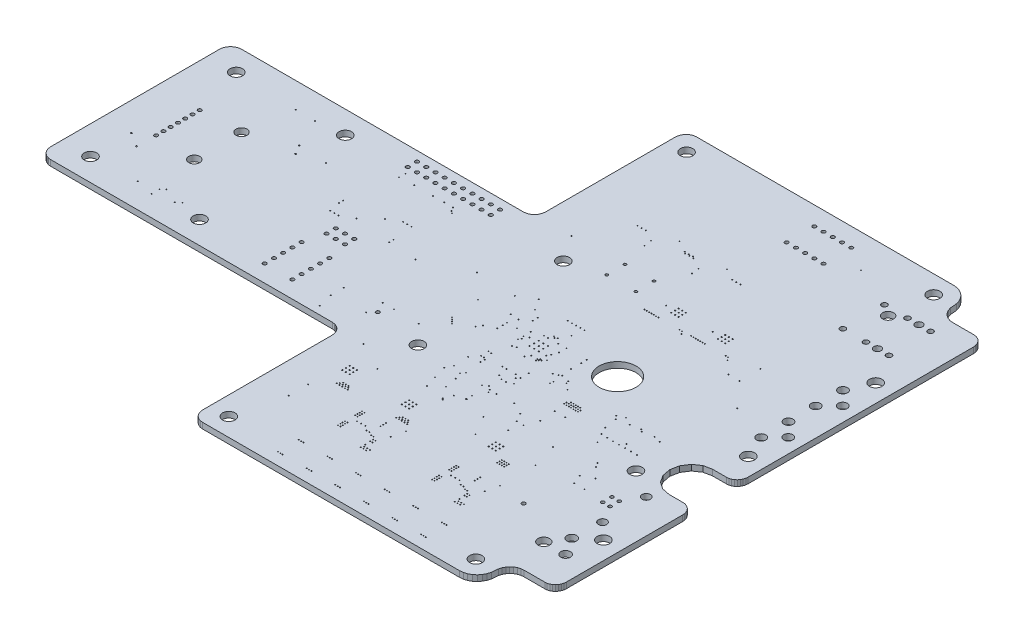
from build123d import *

# Parameters (mm, degrees)
BOARD_OUTLINE_DEPTH = 1.6
SKETCH2_R           = 5.08
SKETCH2_R_2         = 1.15
SKETCH2_R_3         = 1
SKETCH2_R_4         = 1.5
SKETCH2_R_5         = 0.127
SKETCH2_R_6         = 0.1905
SKETCH2_R_7         = 0.508
SKETCH2_R_8         = 1.7145
NPTH_DEPTH          = 116.781160961
SKETCH3_R           = 0.375
SKETCH3_R_2         = 1.59
SKETCH3_R_3         = 1.335
SKETCH3_R_4         = 0.46
SKETCH3_R_5         = 0.75
SKETCH3_R_6         = 1.25
SKETCH3_R_7         = 0.51
SKETCH3_R_8         = 0.5
SKETCH3_R_9         = 0.15
SKETCH3_R_10        = 1.5
PTH_DEPTH           = 116.781160961


with BuildPart() as part:
    # Sketch1 → Board_Outline (new body)
    with BuildSketch(Plane(origin=(0, 0, 0), x_dir=(1, 0, 0), z_dir=(0, 1, 0))):
        Polygon((90.797031, -59), (91.362359, -58.942359), (91.905959, -58.771641), (92.40695, -58.494409), (92.846069, -58.121319), (93.206441, -57.666709), (93.474219, -57.14805), (93.639131, -56.585269), (93.694809, -56), (93.694809, -24), (93.639131, -23.414731), (93.474219, -22.85195), (93.206441, -22.333291), (92.846069, -21.878681), (92.40695, -21.505591), (91.905959, -21.228359), (91.362359, -21.057641), (90.797031, -21), (86.933319, -21), (84.715459, -20.543281), (82.83525, -19.242641), (81.578931, -17.2961), (81.137769, -15), (81.578931, -12.7039), (82.83525, -10.757359), (84.715459, -9.456719), (86.933319, -9), (90.797031, -9), (91.362359, -8.942359), (91.905959, -8.771641), (92.40695, -8.494409), (92.846069, -8.121319), (93.206441, -7.666709), (93.474219, -7.14805), (93.639131, -6.585269), (93.694809, -6), (93.694809, 56), (93.639131, 56.585269), (93.474219, 57.14805), (93.206441, 57.666709), (92.846069, 58.121319), (92.40695, 58.494409), (91.905959, 58.771641), (91.362359, 58.942359), (90.797031, 59), (85.001469, 59), (84.2477, 59.076859), (83.5229, 59.304481), (82.854909, 59.674119), (82.269419, 60.171569), (81.788919, 60.777719), (81.431881, 61.469269), (81.212009, 62.219641), (81.137769, 63), (81.044969, 63.97545), (80.770141, 64.913419), (80.323831, 65.77785), (79.7232, 66.535531), (78.991341, 67.15735), (78.156359, 67.6194), (77.25035, 67.903931), (76.308141, 68), (5.518331, 68), (4.953, 67.942359), (4.4094, 67.771641), (3.908409, 67.494409), (3.469291, 67.121319), (3.108919, 66.666709), (2.841141, 66.14805), (2.676231, 65.585269), (2.62055, 65), (2.62055, 29.337), (2.516692, 28.54812), (2.212195, 27.813), (1.727811, 27.181739), (1.09655, 26.697355), (0.36143, 26.392858), (-0.42745, 26.289), (-77.978, 26.289), (-78.76688, 26.185142), (-79.502, 25.880645), (-80.133261, 25.396261), (-80.617645, 24.765), (-80.922142, 24.02988), (-81.026, 23.241), (-81.026, -23.241), (-80.922142, -24.02988), (-80.617645, -24.765), (-80.133261, -25.396261), (-79.502, -25.880645), (-78.76688, -26.185142), (-77.978, -26.289), (-0.42745, -26.289), (0.36143, -26.392858), (1.09655, -26.697355), (1.727811, -27.181739), (2.212195, -27.813), (2.516692, -28.54812), (2.62055, -29.337), (2.62055, -65), (2.676231, -65.585269), (2.841141, -66.14805), (3.108919, -66.666709), (3.469291, -67.121319), (3.908409, -67.494409), (4.4094, -67.771641), (4.953, -67.942359), (5.518331, -68), (76.308141, -68), (77.25035, -67.903931), (78.156359, -67.6194), (78.991341, -67.15735), (79.7232, -66.535531), (80.323831, -65.77785), (80.770141, -64.913419), (81.044969, -63.97545), (81.137769, -63), (81.212009, -62.219641), (81.431881, -61.469269), (81.788919, -60.777719), (82.269419, -60.171569), (82.854909, -59.674119), (83.5229, -59.304481), (84.2477, -59.076859), (85.001469, -59), align=None)
    extrude(amount=BOARD_OUTLINE_DEPTH)

    # Sketch2 → NPTH (cut, through all)
    with BuildSketch(Plane(origin=(0, 0, 0), x_dir=(1, 0, 0), z_dir=(0, 1, 0))):
        with Locations(Location((51.786, 0, 0), (0, 0, 270))):
            Circle(SKETCH2_R)
        with Locations(Location((84.391, -36.754, 0), (0, 0, 270))):
            Circle(SKETCH2_R_2)
        with Locations(Location((84.391, -24.714, 0), (0, 0, 270))):
            Circle(SKETCH2_R_2)
        with Locations(Location((80.874, 53.839, 0), (0, 0, 270))):
            Circle(SKETCH2_R_3)
        with Locations(Location((80.874, 42.409, 0), (0, 0, 270))):
            Circle(SKETCH2_R_3)
        with Locations(Location((74.524, 51.709, 0), (0, 0, 270))):
            Circle(SKETCH2_R_4)
        with Locations(Location((29.591, -4.191, 0), (0, 0, 270))):
            Circle(SKETCH2_R_5)
        with Locations(Location((29.972, -7.239, 0), (0, 0, 270))):
            Circle(SKETCH2_R_5)
        with Locations(Location((47.244, -22.225, 0), (0, 0, 270))):
            Circle(SKETCH2_R_5)
        with Locations(Location((29.206, -3.306, 0), (0, 0, 270))):
            Circle(SKETCH2_R_5)
        with Locations(Location((29.174, -1.306, 0), (0, 0, 270))):
            Circle(SKETCH2_R_5)
        with Locations(Location((29.19, -4.806, 0), (0, 0, 270))):
            Circle(SKETCH2_R_5)
        with Locations(Location((34.163, -8.001, 0), (0, 0, 270))):
            Circle(SKETCH2_R_5)
        with Locations(Location((38.136, -5.806, 0), (0, 0, 270))):
            Circle(SKETCH2_R_5)
        with Locations(Location((37.993, -2.306, 0), (0, 0, 270))):
            Circle(SKETCH2_R_5)
        with Locations(Location((38.025, -0.306, 0), (0, 0, 270))):
            Circle(SKETCH2_R_5)
        with Locations(Location((34.417, 0.889, 0), (0, 0, 270))):
            Circle(SKETCH2_R_5)
        with Locations(Location((33.909, 0.508, 0), (0, 0, 270))):
            Circle(SKETCH2_R_5)
        with Locations(Location((33.405, 0.893, 0), (0, 0, 270))):
            Circle(SKETCH2_R_5)
        with Locations(Location((55.753, -35.814, 0), (0, 0, 270))):
            Circle(SKETCH2_R_5)
        with Locations(Location((56.388, -35.814, 0), (0, 0, 270))):
            Circle(SKETCH2_R_5)
        with Locations(Location((55.753, -36.449, 0), (0, 0, 270))):
            Circle(SKETCH2_R_5)
        with Locations(Location((56.388, -36.449, 0), (0, 0, 270))):
            Circle(SKETCH2_R_5)
        with Locations(Location((55.753, -37.084, 0), (0, 0, 270))):
            Circle(SKETCH2_R_5)
        with Locations(Location((56.388, -37.084, 0), (0, 0, 270))):
            Circle(SKETCH2_R_5)
        with Locations(Location((57.023, -37.084, 0), (0, 0, 270))):
            Circle(SKETCH2_R_5)
        with Locations(Location((57.023, -36.449, 0), (0, 0, 270))):
            Circle(SKETCH2_R_5)
        with Locations(Location((57.023, -35.814, 0), (0, 0, 270))):
            Circle(SKETCH2_R_5)
        with Locations(Location((57.658, -35.814, 0), (0, 0, 270))):
            Circle(SKETCH2_R_5)
        with Locations(Location((57.658, -36.449, 0), (0, 0, 270))):
            Circle(SKETCH2_R_5)
        with Locations(Location((57.658, -37.084, 0), (0, 0, 270))):
            Circle(SKETCH2_R_5)
        with Locations(Location((50.8, -43.434, 0), (0, 0, 270))):
            Circle(SKETCH2_R_5)
        with Locations(Location((51.435, -43.434, 0), (0, 0, 270))):
            Circle(SKETCH2_R_5)
        with Locations(Location((50.8, -44.069, 0), (0, 0, 270))):
            Circle(SKETCH2_R_5)
        with Locations(Location((51.435, -44.069, 0), (0, 0, 270))):
            Circle(SKETCH2_R_5)
        with Locations(Location((51.435, -44.704, 0), (0, 0, 270))):
            Circle(SKETCH2_R_5)
        with Locations(Location((50.8, -44.704, 0), (0, 0, 270))):
            Circle(SKETCH2_R_5)
        with Locations(Location((50.8, -45.339, 0), (0, 0, 270))):
            Circle(SKETCH2_R_5)
        with Locations(Location((51.435, -45.339, 0), (0, 0, 270))):
            Circle(SKETCH2_R_5)
        with Locations(Location((61.595, -42.164, 0), (0, 0, 270))):
            Circle(SKETCH2_R_5)
        with Locations(Location((35.687, -42.164, 0), (0, 0, 270))):
            Circle(SKETCH2_R_5)
        with Locations(Location((24.892, -43.434, 0), (0, 0, 270))):
            Circle(SKETCH2_R_5)
        with Locations(Location((25.527, -43.434, 0), (0, 0, 270))):
            Circle(SKETCH2_R_5)
        with Locations(Location((24.892, -44.069, 0), (0, 0, 270))):
            Circle(SKETCH2_R_5)
        with Locations(Location((24.892, -44.704, 0), (0, 0, 270))):
            Circle(SKETCH2_R_5)
        with Locations(Location((24.892, -45.339, 0), (0, 0, 270))):
            Circle(SKETCH2_R_5)
        with Locations(Location((25.527, -44.069, 0), (0, 0, 270))):
            Circle(SKETCH2_R_5)
        with Locations(Location((25.527, -44.704, 0), (0, 0, 270))):
            Circle(SKETCH2_R_5)
        with Locations(Location((25.527, -45.339, 0), (0, 0, 270))):
            Circle(SKETCH2_R_5)
        with Locations(Location((14.732, -40.259, 0), (0, 0, 270))):
            Circle(SKETCH2_R_5)
        with Locations(Location((15.113, -39.751, 0), (0, 0, 270))):
            Circle(SKETCH2_R_5)
        with Locations(Location((15.494, -40.259, 0), (0, 0, 270))):
            Circle(SKETCH2_R_5)
        with Locations(Location((15.875, -39.751, 0), (0, 0, 270))):
            Circle(SKETCH2_R_5)
        with Locations(Location((16.256, -40.259, 0), (0, 0, 270))):
            Circle(SKETCH2_R_5)
        with Locations(Location((16.637, -39.751, 0), (0, 0, 270))):
            Circle(SKETCH2_R_5)
        with Locations(Location((17.018, -40.259, 0), (0, 0, 270))):
            Circle(SKETCH2_R_5)
        with Locations(Location((17.399, -39.751, 0), (0, 0, 270))):
            Circle(SKETCH2_R_5)
        with Locations(Location((17.78, -40.259, 0), (0, 0, 270))):
            Circle(SKETCH2_R_5)
        with Locations(Location((17.018, -39.243, 0), (0, 0, 270))):
            Circle(SKETCH2_R_5)
        with Locations(Location((16.256, -39.243, 0), (0, 0, 270))):
            Circle(SKETCH2_R_5)
        with Locations(Location((15.494, -39.243, 0), (0, 0, 270))):
            Circle(SKETCH2_R_5)
        with Locations(Location((31.115, -40.259, 0), (0, 0, 270))):
            Circle(SKETCH2_R_5)
        with Locations(Location((31.496, -39.751, 0), (0, 0, 270))):
            Circle(SKETCH2_R_5)
        with Locations(Location((31.877, -40.259, 0), (0, 0, 270))):
            Circle(SKETCH2_R_5)
        with Locations(Location((32.258, -39.751, 0), (0, 0, 270))):
            Circle(SKETCH2_R_5)
        with Locations(Location((32.639, -40.259, 0), (0, 0, 270))):
            Circle(SKETCH2_R_5)
        with Locations(Location((33.02, -39.751, 0), (0, 0, 270))):
            Circle(SKETCH2_R_5)
        with Locations(Location((33.401, -40.259, 0), (0, 0, 270))):
            Circle(SKETCH2_R_5)
        with Locations(Location((33.782, -39.751, 0), (0, 0, 270))):
            Circle(SKETCH2_R_5)
        with Locations(Location((34.163, -40.259, 0), (0, 0, 270))):
            Circle(SKETCH2_R_5)
        with Locations(Location((33.401, -39.243, 0), (0, 0, 270))):
            Circle(SKETCH2_R_5)
        with Locations(Location((32.639, -39.243, 0), (0, 0, 270))):
            Circle(SKETCH2_R_5)
        with Locations(Location((31.877, -39.243, 0), (0, 0, 270))):
            Circle(SKETCH2_R_5)
        with Locations(Location((50.419, -24.511, 0), (0, 0, 270))):
            Circle(SKETCH2_R_5)
        with Locations(Location((48.514, -24.511, 0), (0, 0, 270))):
            Circle(SKETCH2_R_5)
        with Locations(Location((11.049, -49.784, 0), (0, 0, 270))):
            Circle(SKETCH2_R_5)
        with Locations(Location((61.087, -51.562, 0), (0, 0, 270))):
            Circle(SKETCH2_R_5)
        with Locations(Location((59.182, -50.927, 0), (0, 0, 270))):
            Circle(SKETCH2_R_5)
        with Locations(Location((59.182, -52.197, 0), (0, 0, 270))):
            Circle(SKETCH2_R_5)
        with Locations(Location((59.563, -51.562, 0), (0, 0, 270))):
            Circle(SKETCH2_R_5)
        with Locations(Location((59.944, -52.197, 0), (0, 0, 270))):
            Circle(SKETCH2_R_5)
        with Locations(Location((60.325, -51.562, 0), (0, 0, 270))):
            Circle(SKETCH2_R_5)
        with Locations(Location((60.706, -52.197, 0), (0, 0, 270))):
            Circle(SKETCH2_R_5)
        with Locations(Location((63.627, -58.928, 0), (0, 0, 270))):
            Circle(SKETCH2_R_5)
        with Locations(Location((62.992, -58.928, 0), (0, 0, 270))):
            Circle(SKETCH2_R_5)
        with Locations(Location((62.357, -58.928, 0), (0, 0, 270))):
            Circle(SKETCH2_R_5)
        with Locations(Location((55.753, -58.928, 0), (0, 0, 270))):
            Circle(SKETCH2_R_5)
        with Locations(Location((55.118, -58.928, 0), (0, 0, 270))):
            Circle(SKETCH2_R_5)
        with Locations(Location((54.483, -58.928, 0), (0, 0, 270))):
            Circle(SKETCH2_R_5)
        with Locations(Location((47.879, -58.928, 0), (0, 0, 270))):
            Circle(SKETCH2_R_5)
        with Locations(Location((47.244, -58.928, 0), (0, 0, 270))):
            Circle(SKETCH2_R_5)
        with Locations(Location((46.609, -58.928, 0), (0, 0, 270))):
            Circle(SKETCH2_R_5)
        with Locations(Location((40.005, -58.928, 0), (0, 0, 270))):
            Circle(SKETCH2_R_5)
        with Locations(Location((39.37, -58.928, 0), (0, 0, 270))):
            Circle(SKETCH2_R_5)
        with Locations(Location((38.735, -58.928, 0), (0, 0, 270))):
            Circle(SKETCH2_R_5)
        with Locations(Location((32.131, -58.928, 0), (0, 0, 270))):
            Circle(SKETCH2_R_5)
        with Locations(Location((31.496, -58.928, 0), (0, 0, 270))):
            Circle(SKETCH2_R_5)
        with Locations(Location((30.861, -58.928, 0), (0, 0, 270))):
            Circle(SKETCH2_R_5)
        with Locations(Location((24.257, -58.928, 0), (0, 0, 270))):
            Circle(SKETCH2_R_5)
        with Locations(Location((23.622, -58.928, 0), (0, 0, 270))):
            Circle(SKETCH2_R_5)
        with Locations(Location((22.987, -58.928, 0), (0, 0, 270))):
            Circle(SKETCH2_R_5)
        with Locations(Location((41.529, 23.622, 0), (0, 0, 270))):
            Circle(SKETCH2_R_5)
        with Locations(Location((39.497, 19.685, 0), (0, 0, 270))):
            Circle(SKETCH2_R_5)
        with Locations(Location((40.132, 19.685, 0), (0, 0, 270))):
            Circle(SKETCH2_R_5)
        with Locations(Location((40.767, 19.685, 0), (0, 0, 270))):
            Circle(SKETCH2_R_5)
        with Locations(Location((41.402, 19.685, 0), (0, 0, 270))):
            Circle(SKETCH2_R_5)
        with Locations(Location((42.037, 19.685, 0), (0, 0, 270))):
            Circle(SKETCH2_R_5)
        with Locations(Location((42.672, 19.685, 0), (0, 0, 270))):
            Circle(SKETCH2_R_5)
        with Locations(Location((43.307, 19.685, 0), (0, 0, 270))):
            Circle(SKETCH2_R_5)
        with Locations(Location((52.197, 19.812, 0), (0, 0, 270))):
            Circle(SKETCH2_R_5)
        with Locations(Location((52.832, 19.812, 0), (0, 0, 270))):
            Circle(SKETCH2_R_5)
        with Locations(Location((53.467, 19.812, 0), (0, 0, 270))):
            Circle(SKETCH2_R_5)
        with Locations(Location((54.102, 19.812, 0), (0, 0, 270))):
            Circle(SKETCH2_R_5)
        with Locations(Location((54.737, 19.812, 0), (0, 0, 270))):
            Circle(SKETCH2_R_5)
        with Locations(Location((55.372, 19.812, 0), (0, 0, 270))):
            Circle(SKETCH2_R_5)
        with Locations(Location((56.007, 19.812, 0), (0, 0, 270))):
            Circle(SKETCH2_R_5)
        with Locations(Location((35.179, -51.562, 0), (0, 0, 270))):
            Circle(SKETCH2_R_5)
        with Locations(Location((33.274, -50.927, 0), (0, 0, 270))):
            Circle(SKETCH2_R_5)
        with Locations(Location((33.274, -52.197, 0), (0, 0, 270))):
            Circle(SKETCH2_R_5)
        with Locations(Location((33.655, -51.562, 0), (0, 0, 270))):
            Circle(SKETCH2_R_5)
        with Locations(Location((34.036, -52.197, 0), (0, 0, 270))):
            Circle(SKETCH2_R_5)
        with Locations(Location((34.417, -51.562, 0), (0, 0, 270))):
            Circle(SKETCH2_R_5)
        with Locations(Location((34.798, -52.197, 0), (0, 0, 270))):
            Circle(SKETCH2_R_5)
        with Locations(Location((-50.8, 19.304, 0), (0, 0, 270))):
            Circle(SKETCH2_R_5)
        with Locations(Location((54.229, 23.749, 0), (0, 0, 270))):
            Circle(SKETCH2_R_5)
        with Locations(Location((-47.117, 11.303, 0), (0, 0, 270))):
            Circle(SKETCH2_R_6)
        with Locations(Location((-69.342, -11.303, 0), (0, 0, 270))):
            Circle(SKETCH2_R_6)
        with Locations(Location((57.658, -47.879, 0), (0, 0, 270))):
            Circle(SKETCH2_R_5)
        with Locations(Location((58.293, -47.879, 0), (0, 0, 270))):
            Circle(SKETCH2_R_5)
        with Locations(Location((56.769, -47.371, 0), (0, 0, 270))):
            Circle(SKETCH2_R_5)
        with Locations(Location((56.007, -47.371, 0), (0, 0, 270))):
            Circle(SKETCH2_R_5)
        with Locations(Location((54.737, -46.482, 0), (0, 0, 270))):
            Circle(SKETCH2_R_5)
        with Locations(Location((53.594, -46.482, 0), (0, 0, 270))):
            Circle(SKETCH2_R_5)
        with Locations(Location((52.451, -46.482, 0), (0, 0, 270))):
            Circle(SKETCH2_R_5)
        with Locations(Location((56.896, -44.45, 0), (0, 0, 270))):
            Circle(SKETCH2_R_5)
        with Locations(Location((56.896, -42.926, 0), (0, 0, 270))):
            Circle(SKETCH2_R_5)
        with Locations(Location((56.896, -43.688, 0), (0, 0, 270))):
            Circle(SKETCH2_R_5)
        with Locations(Location((30.988, -42.926, 0), (0, 0, 270))):
            Circle(SKETCH2_R_5)
        with Locations(Location((30.988, -43.688, 0), (0, 0, 270))):
            Circle(SKETCH2_R_5)
        with Locations(Location((30.988, -44.45, 0), (0, 0, 270))):
            Circle(SKETCH2_R_5)
        with Locations(Location((27.686, -46.482, 0), (0, 0, 270))):
            Circle(SKETCH2_R_5)
        with Locations(Location((26.543, -46.482, 0), (0, 0, 270))):
            Circle(SKETCH2_R_5)
        with Locations(Location((28.829, -46.482, 0), (0, 0, 270))):
            Circle(SKETCH2_R_5)
        with Locations(Location((30.099, -47.371, 0), (0, 0, 270))):
            Circle(SKETCH2_R_5)
        with Locations(Location((30.861, -47.371, 0), (0, 0, 270))):
            Circle(SKETCH2_R_5)
        with Locations(Location((31.877, -47.879, 0), (0, 0, 270))):
            Circle(SKETCH2_R_5)
        with Locations(Location((32.512, -47.879, 0), (0, 0, 270))):
            Circle(SKETCH2_R_5)
        with Locations(Location((37.465, 34.798, 0), (0, 0, 270))):
            Circle(SKETCH2_R_5)
        with Locations(Location((31.75, 38.608, 0), (0, 0, 270))):
            Circle(SKETCH2_R_5)
        with Locations(Location((32.893, 38.608, 0), (0, 0, 270))):
            Circle(SKETCH2_R_5)
        with Locations(Location((34.036, 38.608, 0), (0, 0, 270))):
            Circle(SKETCH2_R_5)
        with Locations(Location((44.45, 38.862, 0), (0, 0, 270))):
            Circle(SKETCH2_R_5)
        with Locations(Location((45.593, 38.862, 0), (0, 0, 270))):
            Circle(SKETCH2_R_5)
        with Locations(Location((46.736, 38.862, 0), (0, 0, 270))):
            Circle(SKETCH2_R_5)
        with Locations(Location((24.257, 34.925, 0), (0, 0, 270))):
            Circle(SKETCH2_R_5)
        with Locations(Location((20.828, 38.735, 0), (0, 0, 270))):
            Circle(SKETCH2_R_5)
        with Locations(Location((19.685, 38.735, 0), (0, 0, 270))):
            Circle(SKETCH2_R_5)
        with Locations(Location((18.542, 38.735, 0), (0, 0, 270))):
            Circle(SKETCH2_R_5)
        with Locations(Location((-14.605, 7.366, 0), (0, 0, 270))):
            Circle(SKETCH2_R_5)
        with Locations(Location((-13.462, 7.366, 0), (0, 0, 270))):
            Circle(SKETCH2_R_5)
        with Locations(Location((-12.319, 7.366, 0), (0, 0, 270))):
            Circle(SKETCH2_R_5)
        with Locations(Location((-27.305, 0, 0), (0, 0, 270))):
            Circle(SKETCH2_R_5)
        with Locations(Location((-26.162, 0, 0), (0, 0, 270))):
            Circle(SKETCH2_R_5)
        with Locations(Location((-25.019, 0, 0), (0, 0, 270))):
            Circle(SKETCH2_R_5)
        with Locations(Location((-27.94, 4.191, 0), (0, 0, 270))):
            Circle(SKETCH2_R_5)
        with Locations(Location((-27.94, 3.048, 0), (0, 0, 270))):
            Circle(SKETCH2_R_5)
        with Locations(Location((-11.684, 1.778, 0), (0, 0, 270))):
            Circle(SKETCH2_R_5)
        with Locations(Location((-11.684, 0.635, 0), (0, 0, 270))):
            Circle(SKETCH2_R_5)
        with Locations(Location((-7.112, -20.066, 0), (0, 0, 270))):
            Circle(SKETCH2_R_5)
        with Locations(Location((-7.112, -16.51, 0), (0, 0, 270))):
            Circle(SKETCH2_R_5)
        with Locations(Location((3.429, -17.653, 0), (0, 0, 270))):
            Circle(SKETCH2_R_7)
        with Locations(Location((33.528, 38.989, 0), (0, 0, 270))):
            Circle(SKETCH2_R_5)
        with Locations(Location((32.385, 38.989, 0), (0, 0, 270))):
            Circle(SKETCH2_R_5)
        with Locations(Location((31.242, 38.989, 0), (0, 0, 270))):
            Circle(SKETCH2_R_5)
        with Locations(Location((71.247, -31.369, 0), (0, 0, 270))):
            Circle(SKETCH2_R_5)
        with Locations(Location((43.561, -4.572, 0), (0, 0, 270))):
            Circle(SKETCH2_R_5)
        with Locations(Location((70.231, -28.829, 0), (0, 0, 270))):
            Circle(SKETCH2_R_5)
        with Locations(Location((52.832, -12.573, 0), (0, 0, 270))):
            Circle(SKETCH2_R_5)
        with Locations(Location((52.197, -12.573, 0), (0, 0, 270))):
            Circle(SKETCH2_R_5)
        with Locations(Location((53.467, -12.573, 0), (0, 0, 270))):
            Circle(SKETCH2_R_5)
        with Locations(Location((54.102, -12.573, 0), (0, 0, 270))):
            Circle(SKETCH2_R_5)
        with Locations(Location((51.562, -12.573, 0), (0, 0, 270))):
            Circle(SKETCH2_R_5)
        with Locations(Location((51.562, -13.208, 0), (0, 0, 270))):
            Circle(SKETCH2_R_5)
        with Locations(Location((52.197, -13.208, 0), (0, 0, 270))):
            Circle(SKETCH2_R_5)
        with Locations(Location((52.832, -13.208, 0), (0, 0, 270))):
            Circle(SKETCH2_R_5)
        with Locations(Location((53.467, -13.208, 0), (0, 0, 270))):
            Circle(SKETCH2_R_5)
        with Locations(Location((54.102, -13.208, 0), (0, 0, 270))):
            Circle(SKETCH2_R_5)
        with Locations(Location((54.737, -13.208, 0), (0, 0, 270))):
            Circle(SKETCH2_R_5)
        with Locations(Location((50.927, -13.208, 0), (0, 0, 270))):
            Circle(SKETCH2_R_5)
        with Locations(Location((50.927, -13.843, 0), (0, 0, 270))):
            Circle(SKETCH2_R_5)
        with Locations(Location((51.562, -13.843, 0), (0, 0, 270))):
            Circle(SKETCH2_R_5)
        with Locations(Location((52.197, -13.843, 0), (0, 0, 270))):
            Circle(SKETCH2_R_5)
        with Locations(Location((52.832, -13.843, 0), (0, 0, 270))):
            Circle(SKETCH2_R_5)
        with Locations(Location((53.467, -13.843, 0), (0, 0, 270))):
            Circle(SKETCH2_R_5)
        with Locations(Location((54.102, -13.843, 0), (0, 0, 270))):
            Circle(SKETCH2_R_5)
        with Locations(Location((54.737, -13.843, 0), (0, 0, 270))):
            Circle(SKETCH2_R_5)
        with Locations(Location((49.53, -27.813, 0), (0, 0, 270))):
            Circle(SKETCH2_R_5)
        with Locations(Location((31.623, 6.477, 0), (0, 0, 270))):
            Circle(SKETCH2_R_5)
        with Locations(Location((32.766, 6.477, 0), (0, 0, 270))):
            Circle(SKETCH2_R_5)
        with Locations(Location((33.909, 6.477, 0), (0, 0, 270))):
            Circle(SKETCH2_R_5)
        with Locations(Location((35.052, 6.477, 0), (0, 0, 270))):
            Circle(SKETCH2_R_5)
        with Locations(Location((36.195, 6.477, 0), (0, 0, 270))):
            Circle(SKETCH2_R_5)
        with Locations(Location((24.539, -0.028, 0), (0, 0, 270))):
            Circle(SKETCH2_R_5)
        with Locations(Location((23.749, -2.413, 0), (0, 0, 270))):
            Circle(SKETCH2_R_5)
        with Locations(Location((23.749, -3.556, 0), (0, 0, 270))):
            Circle(SKETCH2_R_5)
        with Locations(Location((23.749, -5.08, 0), (0, 0, 270))):
            Circle(SKETCH2_R_5)
        with Locations(Location((26.396, -2.306, 0), (0, 0, 270))):
            Circle(SKETCH2_R_5)
        with Locations(Location((28.829, -11.811, 0), (0, 0, 270))):
            Circle(SKETCH2_R_5)
        with Locations(Location((33.528, -13.462, 0), (0, 0, 270))):
            Circle(SKETCH2_R_5)
        with Locations(Location((34.671, -13.462, 0), (0, 0, 270))):
            Circle(SKETCH2_R_5)
        with Locations(Location((-54.925, -17.465, 0), (0, 0, 270))):
            Circle(SKETCH2_R_5)
        with Locations(Location((-50.734, -19.365, 0), (0, 0, 270))):
            Circle(SKETCH2_R_5)
        with Locations(Location((24.483, 4.544, 0), (0, 0, 270))):
            Circle(SKETCH2_R_5)
        with Locations(Location((69.088, -43.18, 0), (0, 0, 270))):
            Circle(SKETCH2_R_7)
        with Locations(Location((22.987, -64.643, 0), (0, 0, 270))):
            Circle(SKETCH2_R_5)
        with Locations(Location((23.622, -64.643, 0), (0, 0, 270))):
            Circle(SKETCH2_R_5)
        with Locations(Location((24.257, -64.643, 0), (0, 0, 270))):
            Circle(SKETCH2_R_5)
        with Locations(Location((30.861, -64.643, 0), (0, 0, 270))):
            Circle(SKETCH2_R_5)
        with Locations(Location((31.496, -64.643, 0), (0, 0, 270))):
            Circle(SKETCH2_R_5)
        with Locations(Location((32.131, -64.643, 0), (0, 0, 270))):
            Circle(SKETCH2_R_5)
        with Locations(Location((38.735, -64.643, 0), (0, 0, 270))):
            Circle(SKETCH2_R_5)
        with Locations(Location((39.37, -64.643, 0), (0, 0, 270))):
            Circle(SKETCH2_R_5)
        with Locations(Location((40.005, -64.643, 0), (0, 0, 270))):
            Circle(SKETCH2_R_5)
        with Locations(Location((46.609, -64.643, 0), (0, 0, 270))):
            Circle(SKETCH2_R_5)
        with Locations(Location((47.244, -64.643, 0), (0, 0, 270))):
            Circle(SKETCH2_R_5)
        with Locations(Location((47.879, -64.643, 0), (0, 0, 270))):
            Circle(SKETCH2_R_5)
        with Locations(Location((54.483, -64.643, 0), (0, 0, 270))):
            Circle(SKETCH2_R_5)
        with Locations(Location((55.118, -64.643, 0), (0, 0, 270))):
            Circle(SKETCH2_R_5)
        with Locations(Location((55.753, -64.643, 0), (0, 0, 270))):
            Circle(SKETCH2_R_5)
        with Locations(Location((62.357, -64.643, 0), (0, 0, 270))):
            Circle(SKETCH2_R_5)
        with Locations(Location((62.992, -64.643, 0), (0, 0, 270))):
            Circle(SKETCH2_R_5)
        with Locations(Location((63.627, -64.643, 0), (0, 0, 270))):
            Circle(SKETCH2_R_5)
        with Locations(Location((64.897, -16.002, 0), (0, 0, 270))):
            Circle(SKETCH2_R_5)
        with Locations(Location((66.548, -16.002, 0), (0, 0, 270))):
            Circle(SKETCH2_R_5)
        with Locations(Location((68.199, -16.002, 0), (0, 0, 270))):
            Circle(SKETCH2_R_5)
        with Locations(Location((69.85, -16.002, 0), (0, 0, 270))):
            Circle(SKETCH2_R_5)
        with Locations(Location((71.501, -16.002, 0), (0, 0, 270))):
            Circle(SKETCH2_R_5)
        with Locations(Location((73.152, -16.002, 0), (0, 0, 270))):
            Circle(SKETCH2_R_5)
        with Locations(Location((63.246, -15.875, 0), (0, 0, 270))):
            Circle(SKETCH2_R_5)
        with Locations(Location((29.972, -22.733, 0), (0, 0, 270))):
            Circle(SKETCH2_R_5)
        with Locations(Location((25.781, -21.717, 0), (0, 0, 270))):
            Circle(SKETCH2_R_5)
        with Locations(Location((29.972, -19.939, 0), (0, 0, 270))):
            Circle(SKETCH2_R_5)
        with Locations(Location((37.211, -13.462, 0), (0, 0, 270))):
            Circle(SKETCH2_R_5)
        with Locations(Location((36.449, -16.637, 0), (0, 0, 270))):
            Circle(SKETCH2_R_5)
        with Locations(Location((37.719, -16.637, 0), (0, 0, 270))):
            Circle(SKETCH2_R_5)
        with Locations(Location((39.243, -16.002, 0), (0, 0, 270))):
            Circle(SKETCH2_R_5)
        with Locations(Location((35.179, -16.002, 0), (0, 0, 270))):
            Circle(SKETCH2_R_5)
        with Locations(Location((35.179, -20.701, 0), (0, 0, 270))):
            Circle(SKETCH2_R_5)
        with Locations(Location((37.338, -20.701, 0), (0, 0, 270))):
            Circle(SKETCH2_R_5)
        with Locations(Location((37.719, -21.463, 0), (0, 0, 270))):
            Circle(SKETCH2_R_5)
        with Locations(Location((39.243, -20.828, 0), (0, 0, 270))):
            Circle(SKETCH2_R_5)
        with Locations(Location((21.082, -6.35, 0), (0, 0, 270))):
            Circle(SKETCH2_R_5)
        with Locations(Location((20.32, -7.62, 0), (0, 0, 270))):
            Circle(SKETCH2_R_5)
        with Locations(Location((22.225, 0.127, 0), (0, 0, 270))):
            Circle(SKETCH2_R_5)
        with Locations(Location((43.307, -7.747, 0), (0, 0, 270))):
            Circle(SKETCH2_R_5)
        with Locations(Location((43.942, -7.366, 0), (0, 0, 270))):
            Circle(SKETCH2_R_5)
        with Locations(Location((43.561, -0.254, 0), (0, 0, 270))):
            Circle(SKETCH2_R_5)
        with Locations(Location((43.561, -1.778, 0), (0, 0, 270))):
            Circle(SKETCH2_R_5)
        with Locations(Location((-56.134, 19.304, 0), (0, 0, 270))):
            Circle(SKETCH2_R_5)
        with Locations(Location((11.049, -44.45, 0), (0, 0, 270))):
            Circle(SKETCH2_R_5)
        with Locations(Location((42.926, -28.067, 0), (0, 0, 270))):
            Circle(SKETCH2_R_5)
        with Locations(Location((9.017, -27.178, 0), (0, 0, 270))):
            Circle(SKETCH2_R_5)
        with Locations(Location((26.797, -25.273, 0), (0, 0, 270))):
            Circle(SKETCH2_R_5)
        with Locations(Location((66.548, 15.748, 0), (0, 0, 270))):
            Circle(SKETCH2_R_5)
        with Locations(Location((69.596, 15.748, 0), (0, 0, 270))):
            Circle(SKETCH2_R_5)
        with Locations(Location((61.595, -32.385, 0), (0, 0, 270))):
            Circle(SKETCH2_R_5)
        with Locations(Location((14.224, -0.889, 0), (0, 0, 270))):
            Circle(SKETCH2_R_5)
        with Locations(Location((18.415, 5.08, 0), (0, 0, 270))):
            Circle(SKETCH2_R_5)
        with Locations(Location((75.819, 8.89, 0), (0, 0, 270))):
            Circle(SKETCH2_R_5)
        with Locations(Location((59.944, 58.801, 0), (0, 0, 270))):
            Circle(SKETCH2_R_5)
        with Locations(Location((74.041, -31.369, 0), (0, 0, 270))):
            Circle(SKETCH2_R_5)
        with Locations(Location((-73.152, -8.89, 0), (0, 0, 270))):
            Circle(SKETCH2_R_6)
        with Locations(Location((-45.593, 8.763, 0), (0, 0, 270))):
            Circle(SKETCH2_R_6)
        with Locations(Location((42.164, -8.255, 0), (0, 0, 270))):
            Circle(SKETCH2_R_5)
        with Locations(Location((11.811, -14.732, 0), (0, 0, 270))):
            Circle(SKETCH2_R_5)
        with Locations(Location((46.355, -8.636, 0), (0, 0, 270))):
            Circle(SKETCH2_R_5)
        with Locations(Location((60.96, -9.525, 0), (0, 0, 270))):
            Circle(SKETCH2_R_5)
        with Locations(Location((1.905, -19.304, 0), (0, 0, 270))):
            Circle(SKETCH2_R_5)
        with Locations(Location((16.891, -31.242, 0), (0, 0, 270))):
            Circle(SKETCH2_R_5)
        with Locations(Location((71.247, -9.271, 0), (0, 0, 270))):
            Circle(SKETCH2_R_5)
        with Locations(Location((67.564, -9.271, 0), (0, 0, 270))):
            Circle(SKETCH2_R_5)
        with Locations(Location((70.358, -24.511, 0), (0, 0, 270))):
            Circle(SKETCH2_R_5)
        with Locations(Location((51.689, -21.209, 0), (0, 0, 270))):
            Circle(SKETCH2_R_5)
        with Locations(Location((30.341, -2.806, 0), (0, 0, 270))):
            Circle(SKETCH2_R_5)
        with Locations(Location((30.905, -6.858, 0), (0, 0, 270))):
            Circle(SKETCH2_R_5)
        with Locations(Location((34.889, -6.858, 0), (0, 0, 270))):
            Circle(SKETCH2_R_5)
        with Locations(Location((36.937, -4.806, 0), (0, 0, 270))):
            Circle(SKETCH2_R_5)
        with Locations(Location((35.762, -0.329, 0), (0, 0, 270))):
            Circle(SKETCH2_R_5)
        with Locations(Location((31.905, -0.353, 0), (0, 0, 270))):
            Circle(SKETCH2_R_5)
        with Locations(Location((43.942, -20.574, 0), (0, 0, 270))):
            Circle(SKETCH2_R_5)
        with Locations(Location((51.336, -16.863, 0), (0, 0, 270))):
            Circle(SKETCH2_R_5)
        with Locations(Location((37.084, -6.985, 0), (0, 0, 270))):
            Circle(SKETCH2_R_5)
        with Locations(Location((36.576, -6.858, 0), (0, 0, 270))):
            Circle(SKETCH2_R_5)
        with Locations(Location((36.957, -6.477, 0), (0, 0, 270))):
            Circle(SKETCH2_R_5)
        with Locations(Location((37.465, -6.604, 0), (0, 0, 270))):
            Circle(SKETCH2_R_5)
        with Locations(Location((36.703, -7.366, 0), (0, 0, 270))):
            Circle(SKETCH2_R_5)
        with Locations(Location((26.67, -19.939, 0), (0, 0, 270))):
            Circle(SKETCH2_R_5)
        with Locations(Location((33.782, -27.051, 0), (0, 0, 270))):
            Circle(SKETCH2_R_5)
        with Locations(Location((36.322, -19.939, 0), (0, 0, 270))):
            Circle(SKETCH2_R_5)
        with Locations(Location((36.322, -26.162, 0), (0, 0, 270))):
            Circle(SKETCH2_R_6)
        with Locations(Location((36.322, -24.638, 0), (0, 0, 270))):
            Circle(SKETCH2_R_5)
        with Locations(Location((32.893, -29.21, 0), (0, 0, 270))):
            Circle(SKETCH2_R_5)
        with Locations(Location((33.274, -29.591, 0), (0, 0, 270))):
            Circle(SKETCH2_R_5)
        with Locations(Location((30.607, -26.035, 0), (0, 0, 270))):
            Circle(SKETCH2_R_5)
        with Locations(Location((1.905, -14.732, 0), (0, 0, 270))):
            Circle(SKETCH2_R_5)
        with Locations(Location((4.953, -14.732, 0), (0, 0, 270))):
            Circle(SKETCH2_R_5)
        with Locations(Location((59.69, -25.654, 0), (0, 0, 270))):
            Circle(SKETCH2_R_5)
        with Locations(Location((54.272, -16.863, 0), (0, 0, 270))):
            Circle(SKETCH2_R_5)
        with Locations(Location((73.152, -9.779, 0), (0, 0, 270))):
            Circle(SKETCH2_R_5)
        with Locations(Location((61.722, -10.414, 0), (0, 0, 270))):
            Circle(SKETCH2_R_5)
        with Locations(Location((69.088, -14.859, 0), (0, 0, 270))):
            Circle(SKETCH2_R_5)
        with Locations(Location((69.596, -23.368, 0), (0, 0, 270))):
            Circle(SKETCH2_R_5)
        with Locations(Location((44.069, -10.922, 0), (0, 0, 270))):
            Circle(SKETCH2_R_5)
        with Locations(Location((38.1, -14.351, 0), (0, 0, 270))):
            Circle(SKETCH2_R_5)
        with Locations(Location((44.196, -10.033, 0), (0, 0, 270))):
            Circle(SKETCH2_R_5)
        with Locations(Location((38.735, -13.716, 0), (0, 0, 270))):
            Circle(SKETCH2_R_5)
        with Locations(Location((33.02, -0.381, 0), (0, 0, 270))):
            Circle(SKETCH2_R_5)
        with Locations(Location((27.94, -11.684, 0), (0, 0, 270))):
            Circle(SKETCH2_R_5)
        with Locations(Location((26.543, -15.875, 0), (0, 0, 270))):
            Circle(SKETCH2_R_5)
        with Locations(Location((29.276, -20.889, 0), (0, 0, 270))):
            Circle(SKETCH2_R_5)
        with Locations(Location((26.797, 1.651, 0), (0, 0, 270))):
            Circle(SKETCH2_R_5)
        with Locations(Location((26.797, 3.048, 0), (0, 0, 270))):
            Circle(SKETCH2_R_5)
        with Locations(Location((35.687, 3.429, 0), (0, 0, 270))):
            Circle(SKETCH2_R_5)
        with Locations(Location((7.62, 5.461, 0), (0, 0, 270))):
            Circle(SKETCH2_R_5)
        with Locations(Location((-3.937, 0.127, 0), (0, 0, 270))):
            Circle(SKETCH2_R_5)
        with Locations(Location((-49.53, -18.415, 0), (0, 0, 270))):
            Circle(SKETCH2_R_5)
        with Locations(Location((46.101, -7.874, 0), (0, 0, 270))):
            Circle(SKETCH2_R_5)
        with Locations(Location((48.006, -10.033, 0), (0, 0, 270))):
            Circle(SKETCH2_R_5)
        with Locations(Location((-6.096, -24.13, 0), (0, 0, 270))):
            Circle(SKETCH2_R_5)
        with Locations(Location((-55.88, -20.574, 0), (0, 0, 270))):
            Circle(SKETCH2_R_5)
        with Locations(Location((-55.88, -18.415, 0), (0, 0, 270))):
            Circle(SKETCH2_R_5)
        with Locations(Location((62.738, -8.636, 0), (0, 0, 270))):
            Circle(SKETCH2_R_5)
        with Locations(Location((28.829, -13.843, 0), (0, 0, 270))):
            Circle(SKETCH2_R_5)
        with Locations(Location((-13.589, 17.653, 0), (0, 0, 270))):
            Circle(SKETCH2_R_5)
        with Locations(Location((28.067, -13.843, 0), (0, 0, 270))):
            Circle(SKETCH2_R_5)
        with Locations(Location((29.464, -14.224, 0), (0, 0, 270))):
            Circle(SKETCH2_R_5)
        with Locations(Location((-16.637, 17.653, 0), (0, 0, 270))):
            Circle(SKETCH2_R_5)
        with Locations(Location((29.464, -15.367, 0), (0, 0, 270))):
            Circle(SKETCH2_R_5)
        with Locations(Location((-21.844, 17.653, 0), (0, 0, 270))):
            Circle(SKETCH2_R_5)
        with Locations(Location((68.199, -9.779, 0), (0, 0, 270))):
            Circle(SKETCH2_R_5)
        with Locations(Location((62.23, -13.843, 0), (0, 0, 270))):
            Circle(SKETCH2_R_5)
        with Locations(Location((14.859, -8.636, 0), (0, 0, 270))):
            Circle(SKETCH2_R_5)
        with Locations(Location((-9.906, 16.129, 0), (0, 0, 270))):
            Circle(SKETCH2_R_5)
        with Locations(Location((-25.781, 17.399, 0), (0, 0, 270))):
            Circle(SKETCH2_R_5)
        with Locations(Location((15.367, -9.144, 0), (0, 0, 270))):
            Circle(SKETCH2_R_5)
        with Locations(Location((-10.541, 16.637, 0), (0, 0, 270))):
            Circle(SKETCH2_R_5)
        with Locations(Location((-25.781, 19.177, 0), (0, 0, 270))):
            Circle(SKETCH2_R_5)
        with Locations(Location((15.875, -9.652, 0), (0, 0, 270))):
            Circle(SKETCH2_R_5)
        with Locations(Location((-11.176, 17.653, 0), (0, 0, 270))):
            Circle(SKETCH2_R_5)
        with Locations(Location((16.383, -10.16, 0), (0, 0, 270))):
            Circle(SKETCH2_R_5)
        with Locations(Location((33.147, -48.641, 0), (0, 0, 270))):
            Circle(SKETCH2_R_5)
        with Locations(Location((33.147, -49.403, 0), (0, 0, 270))):
            Circle(SKETCH2_R_5)
        with Locations(Location((33.782, -49.403, 0), (0, 0, 270))):
            Circle(SKETCH2_R_5)
        with Locations(Location((33.782, -48.641, 0), (0, 0, 270))):
            Circle(SKETCH2_R_5)
        with Locations(Location((34.925, -45.593, 0), (0, 0, 270))):
            Circle(SKETCH2_R_5)
        with Locations(Location((24.892, -48.133, 0), (0, 0, 270))):
            Circle(SKETCH2_R_5)
        with Locations(Location((25.527, -48.133, 0), (0, 0, 270))):
            Circle(SKETCH2_R_5)
        with Locations(Location((25.527, -48.768, 0), (0, 0, 270))):
            Circle(SKETCH2_R_5)
        with Locations(Location((25.527, -49.403, 0), (0, 0, 270))):
            Circle(SKETCH2_R_5)
        with Locations(Location((25.527, -50.038, 0), (0, 0, 270))):
            Circle(SKETCH2_R_5)
        with Locations(Location((24.892, -50.038, 0), (0, 0, 270))):
            Circle(SKETCH2_R_5)
        with Locations(Location((24.892, -49.403, 0), (0, 0, 270))):
            Circle(SKETCH2_R_5)
        with Locations(Location((24.892, -48.768, 0), (0, 0, 270))):
            Circle(SKETCH2_R_5)
        with Locations(Location((59.055, -48.641, 0), (0, 0, 270))):
            Circle(SKETCH2_R_5)
        with Locations(Location((59.69, -48.641, 0), (0, 0, 270))):
            Circle(SKETCH2_R_5)
        with Locations(Location((59.055, -49.403, 0), (0, 0, 270))):
            Circle(SKETCH2_R_5)
        with Locations(Location((59.69, -49.403, 0), (0, 0, 270))):
            Circle(SKETCH2_R_5)
        with Locations(Location((60.833, -45.593, 0), (0, 0, 270))):
            Circle(SKETCH2_R_5)
        with Locations(Location((50.8, -50.038, 0), (0, 0, 270))):
            Circle(SKETCH2_R_5)
        with Locations(Location((51.435, -50.038, 0), (0, 0, 270))):
            Circle(SKETCH2_R_5)
        with Locations(Location((50.8, -49.403, 0), (0, 0, 270))):
            Circle(SKETCH2_R_5)
        with Locations(Location((51.435, -49.403, 0), (0, 0, 270))):
            Circle(SKETCH2_R_5)
        with Locations(Location((51.435, -48.768, 0), (0, 0, 270))):
            Circle(SKETCH2_R_5)
        with Locations(Location((50.8, -48.768, 0), (0, 0, 270))):
            Circle(SKETCH2_R_5)
        with Locations(Location((50.8, -48.133, 0), (0, 0, 270))):
            Circle(SKETCH2_R_5)
        with Locations(Location((51.435, -48.133, 0), (0, 0, 270))):
            Circle(SKETCH2_R_5)
        with Locations(Location((11.938, 27.178, 0), (0, 0, 270))):
            Circle(SKETCH2_R_5)
        with Locations(Location((-60.833, -19.431, 0), (0, 0, 270))):
            Circle(SKETCH2_R_5)
        with Locations(Location((-39.243, 10.795, 0), (0, 0, 270))):
            Circle(SKETCH2_R_5)
        with Locations(Location((-73.223, 20.066, 0), (0, 0, 270))):
            Circle(SKETCH2_R_8)
        with Locations(Location((-43.223, 20.066, 0), (0, 0, 270))):
            Circle(SKETCH2_R_8)
        with Locations(Location((-73.223, -20.066, 0), (0, 0, 270))):
            Circle(SKETCH2_R_8)
        with Locations(Location((-43.223, -20.066, 0), (0, 0, 270))):
            Circle(SKETCH2_R_8)
        with Locations(Location((16.773, 20.066, 0), (0, 0, 270))):
            Circle(SKETCH2_R_8)
        with Locations(Location((16.773, -19.939, 0), (0, 0, 270))):
            Circle(SKETCH2_R_8)
        with Locations(Location((7.773, -62.992, 0), (0, 0, 270))):
            Circle(SKETCH2_R_8)
        with Locations(Location((75.773, -62.992, 0), (0, 0, 270))):
            Circle(SKETCH2_R_8)
        with Locations(Location((76.773, -19.939, 0), (0, 0, 270))):
            Circle(SKETCH2_R_8)
        with Locations(Location((7.773, 62.992, 0), (0, 0, 270))):
            Circle(SKETCH2_R_8)
        with Locations(Location((75.773, 62.992, 0), (0, 0, 270))):
            Circle(SKETCH2_R_8)
        with Locations(Location((88.773, 34.036, 0), (0, 0, 270))):
            Circle(SKETCH2_R_8)
        with Locations(Location((88.773, -1.016, 0), (0, 0, 270))):
            Circle(SKETCH2_R_8)
        with Locations(Location((22.479, 7.62, 0), (0, 0, 270))):
            Circle(SKETCH2_R_5)
        with Locations(Location((88.773, -40.894, 0), (0, 0, 270))):
            Circle(SKETCH2_R_8)
        with Locations(Location((45.974, -33.274, 0), (0, 0, 270))):
            Circle(SKETCH2_R_5)
        with Locations(Location((27.813, -28.448, 0), (0, 0, 270))):
            Circle(SKETCH2_R_5)
        with Locations(Location((64.643, -18.415, 0), (0, 0, 270))):
            Circle(SKETCH2_R_5)
        with Locations(Location((38.735, -11.43, 0), (0, 0, 270))):
            Circle(SKETCH2_R_5)
        with Locations(Location((64.897, -9.779, 0), (0, 0, 270))):
            Circle(SKETCH2_R_5)
        with Locations(Location((37.465, -3.937, 0), (0, 0, 270))):
            Circle(SKETCH2_R_5)
        with Locations(Location((73.025, -27.305, 0), (0, 0, 270))):
            Circle(SKETCH2_R_5)
        with Locations(Location((49.149, 19.685, 0), (0, 0, 270))):
            Circle(SKETCH2_R_5)
        with Locations(Location((50.419, 18.923, 0), (0, 0, 270))):
            Circle(SKETCH2_R_5)
        with Locations(Location((37.211, 36.83, 0), (0, 0, 270))):
            Circle(SKETCH2_R_5)
        with Locations(Location((24.003, 36.957, 0), (0, 0, 270))):
            Circle(SKETCH2_R_5)
        with Locations(Location((-17.78, 5.588, 0), (0, 0, 270))):
            Circle(SKETCH2_R_5)
        with Locations(Location((49.784, 19.685, 0), (0, 0, 270))):
            Circle(SKETCH2_R_5)
        with Locations(Location((69.596, 21.463, 0), (0, 0, 270))):
            Circle(SKETCH2_R_5)
        with Locations(Location((61.722, 19.812, 0), (0, 0, 270))):
            Circle(SKETCH2_R_5)
        with Locations(Location((62.992, 19.05, 0), (0, 0, 270))):
            Circle(SKETCH2_R_5)
        with Locations(Location((41.275, 40.64, 0), (0, 0, 270))):
            Circle(SKETCH2_R_5)
        with Locations(Location((-21.844, 1.778, 0), (0, 0, 270))):
            Circle(SKETCH2_R_5)
        with Locations(Location((62.357, 19.812, 0), (0, 0, 270))):
            Circle(SKETCH2_R_5)
        with Locations(Location((28.067, 40.767, 0), (0, 0, 270))):
            Circle(SKETCH2_R_5)
    extrude(amount=NPTH_DEPTH, mode=Mode.SUBTRACT)

    # Sketch3 → PTH (cut, through all)
    with BuildSketch(Plane(origin=(0, 0, 0), x_dir=(1, 0, 0), z_dir=(0, 1, 0))):
        with Locations(Location((26.04, 22.77, 0), (0, 0, 270))):
            Circle(SKETCH3_R)
        with Locations(Location((26.04, 27.77, 0), (0, 0, 270))):
            Circle(SKETCH3_R)
        with Locations(Location((34.04, 22.77, 0), (0, 0, 270))):
            Circle(SKETCH3_R)
        with Locations(Location((34.04, 27.77, 0), (0, 0, 270))):
            Circle(SKETCH3_R)
        with Locations(Location((81, -49.53, 0), (0, 0, 270))):
            Circle(SKETCH3_R_2)
        with Locations(Location((87, -49.53, 0), (0, 0, 270))):
            Circle(SKETCH3_R_3)
        with Locations(Location((84, -44.83, 0), (0, 0, 270))):
            Circle(SKETCH3_R_3)
        with Locations(Location((79.68, -29.48, 0), (0, 0, 270))):
            Circle(SKETCH3_R_4)
        with Locations(Location((79.68, -31.98, 0), (0, 0, 270))):
            Circle(SKETCH3_R_4)
        with Locations(Location((81.68, -31.98, 0), (0, 0, 270))):
            Circle(SKETCH3_R_4)
        with Locations(Location((81.68, -29.48, 0), (0, 0, 270))):
            Circle(SKETCH3_R_4)
        with Locations(Location((77.72, 53.84, 0), (0, 0, 270))):
            Circle(SKETCH3_R_5)
        with Locations(Location((77.72, 42.41, 0), (0, 0, 270))):
            Circle(SKETCH3_R_5)
        with Locations(Location((84.07, 53.84, 0), (0, 0, 270))):
            Circle(SKETCH3_R_5)
        with Locations(Location((84.07, 42.41, 0), (0, 0, 270))):
            Circle(SKETCH3_R_5)
        with Locations(Location((71.37, 53.84, 0), (0, 0, 270))):
            Circle(SKETCH3_R_5)
        with Locations(Location((71.37, 42.41, 0), (0, 0, 270))):
            Circle(SKETCH3_R_5)
        with Locations(Location((86.04, 27.76, 0), (0, 0, 270))):
            Circle(SKETCH3_R_6)
        with Locations(Location((89.74, 24.01, 0), (0, 0, 270))):
            Circle(SKETCH3_R_6)
        with Locations(Location((86.04, 20.26, 0), (0, 0, 270))):
            Circle(SKETCH3_R_6)
        with Locations(Location((86.04, 12.76, 0), (0, 0, 270))):
            Circle(SKETCH3_R_6)
        with Locations(Location((89.74, 9.01, 0), (0, 0, 270))):
            Circle(SKETCH3_R_6)
        with Locations(Location((86.04, 5.26, 0), (0, 0, 270))):
            Circle(SKETCH3_R_6)
        with Locations(Location((-22.35, -5.97, 0), (0, 0, 270))):
            Circle(SKETCH3_R_7)
        with Locations(Location((-22.35, -3.43, 0), (0, 0, 270))):
            Circle(SKETCH3_R_7)
        with Locations(Location((-19.81, -5.97, 0), (0, 0, 270))):
            Circle(SKETCH3_R_7)
        with Locations(Location((-19.81, -3.43, 0), (0, 0, 270))):
            Circle(SKETCH3_R_7)
        with Locations(Location((-17.27, -5.97, 0), (0, 0, 270))):
            Circle(SKETCH3_R_7)
        with Locations(Location((-17.27, -3.43, 0), (0, 0, 270))):
            Circle(SKETCH3_R_7)
        with Locations(Location((-27.05, 21.08, 0), (0, 0, 270))):
            Circle(SKETCH3_R_7)
        with Locations(Location((-27.05, 23.62, 0), (0, 0, 270))):
            Circle(SKETCH3_R_7)
        with Locations(Location((-24.51, 21.08, 0), (0, 0, 270))):
            Circle(SKETCH3_R_7)
        with Locations(Location((-24.51, 23.62, 0), (0, 0, 270))):
            Circle(SKETCH3_R_7)
        with Locations(Location((-21.97, 21.08, 0), (0, 0, 270))):
            Circle(SKETCH3_R_7)
        with Locations(Location((-21.97, 23.62, 0), (0, 0, 270))):
            Circle(SKETCH3_R_7)
        with Locations(Location((-19.43, 21.08, 0), (0, 0, 270))):
            Circle(SKETCH3_R_7)
        with Locations(Location((-19.43, 23.62, 0), (0, 0, 270))):
            Circle(SKETCH3_R_7)
        with Locations(Location((-16.89, 21.08, 0), (0, 0, 270))):
            Circle(SKETCH3_R_7)
        with Locations(Location((-16.89, 23.62, 0), (0, 0, 270))):
            Circle(SKETCH3_R_7)
        with Locations(Location((-14.35, 21.08, 0), (0, 0, 270))):
            Circle(SKETCH3_R_7)
        with Locations(Location((-14.35, 23.62, 0), (0, 0, 270))):
            Circle(SKETCH3_R_7)
        with Locations(Location((-11.81, 21.08, 0), (0, 0, 270))):
            Circle(SKETCH3_R_7)
        with Locations(Location((-11.81, 23.62, 0), (0, 0, 270))):
            Circle(SKETCH3_R_7)
        with Locations(Location((-9.27, 21.08, 0), (0, 0, 270))):
            Circle(SKETCH3_R_7)
        with Locations(Location((-9.27, 23.62, 0), (0, 0, 270))):
            Circle(SKETCH3_R_7)
        with Locations(Location((-6.73, 21.08, 0), (0, 0, 270))):
            Circle(SKETCH3_R_7)
        with Locations(Location((-6.73, 23.62, 0), (0, 0, 270))):
            Circle(SKETCH3_R_7)
        with Locations(Location((-4.19, 21.08, 0), (0, 0, 270))):
            Circle(SKETCH3_R_7)
        with Locations(Location((-4.19, 23.62, 0), (0, 0, 270))):
            Circle(SKETCH3_R_7)
        with Locations(Location((-16.13, -21.59, 0), (0, 0, 270))):
            Circle(SKETCH3_R_8)
        with Locations(Location((-16.13, -19.05, 0), (0, 0, 270))):
            Circle(SKETCH3_R_8)
        with Locations(Location((-16.13, -16.51, 0), (0, 0, 270))):
            Circle(SKETCH3_R_8)
        with Locations(Location((-16.13, -13.97, 0), (0, 0, 270))):
            Circle(SKETCH3_R_8)
        with Locations(Location((-16.13, -11.43, 0), (0, 0, 270))):
            Circle(SKETCH3_R_8)
        with Locations(Location((-23.75, -11.43, 0), (0, 0, 270))):
            Circle(SKETCH3_R_8)
        with Locations(Location((-23.75, -13.97, 0), (0, 0, 270))):
            Circle(SKETCH3_R_8)
        with Locations(Location((-23.75, -16.51, 0), (0, 0, 270))):
            Circle(SKETCH3_R_8)
        with Locations(Location((-23.75, -19.05, 0), (0, 0, 270))):
            Circle(SKETCH3_R_8)
        with Locations(Location((-23.75, -21.59, 0), (0, 0, 270))):
            Circle(SKETCH3_R_8)
        with Locations(Location((53.21, 62.87, 0), (0, 0, 270))):
            Circle(SKETCH3_R_8)
        with Locations(Location((50.67, 62.87, 0), (0, 0, 270))):
            Circle(SKETCH3_R_8)
        with Locations(Location((48.13, 62.87, 0), (0, 0, 270))):
            Circle(SKETCH3_R_8)
        with Locations(Location((45.59, 62.87, 0), (0, 0, 270))):
            Circle(SKETCH3_R_8)
        with Locations(Location((43.05, 62.87, 0), (0, 0, 270))):
            Circle(SKETCH3_R_8)
        with Locations(Location((43.05, 55.25, 0), (0, 0, 270))):
            Circle(SKETCH3_R_8)
        with Locations(Location((45.59, 55.25, 0), (0, 0, 270))):
            Circle(SKETCH3_R_8)
        with Locations(Location((48.13, 55.25, 0), (0, 0, 270))):
            Circle(SKETCH3_R_8)
        with Locations(Location((50.67, 55.25, 0), (0, 0, 270))):
            Circle(SKETCH3_R_8)
        with Locations(Location((53.21, 55.25, 0), (0, 0, 270))):
            Circle(SKETCH3_R_8)
        with Locations(Location((32.38, -2.29, 0), (0, 0, 270))):
            Circle(SKETCH3_R_9)
        with Locations(Location((33.66, -2.29, 0), (0, 0, 270))):
            Circle(SKETCH3_R_9)
        with Locations(Location((34.93, -2.29, 0), (0, 0, 270))):
            Circle(SKETCH3_R_9)
        with Locations(Location((32.38, -3.56, 0), (0, 0, 270))):
            Circle(SKETCH3_R_9)
        with Locations(Location((33.66, -3.56, 0), (0, 0, 270))):
            Circle(SKETCH3_R_9)
        with Locations(Location((34.93, -3.56, 0), (0, 0, 270))):
            Circle(SKETCH3_R_9)
        with Locations(Location((32.38, -4.83, 0), (0, 0, 270))):
            Circle(SKETCH3_R_9)
        with Locations(Location((33.66, -4.83, 0), (0, 0, 270))):
            Circle(SKETCH3_R_9)
        with Locations(Location((34.93, -4.83, 0), (0, 0, 270))):
            Circle(SKETCH3_R_9)
        with Locations(Location((29.72, -35.31, 0), (0, 0, 270))):
            Circle(SKETCH3_R_9)
        with Locations(Location((30.72, -35.31, 0), (0, 0, 270))):
            Circle(SKETCH3_R_9)
        with Locations(Location((28.72, -35.31, 0), (0, 0, 270))):
            Circle(SKETCH3_R_9)
        with Locations(Location((28.72, -36.31, 0), (0, 0, 270))):
            Circle(SKETCH3_R_9)
        with Locations(Location((29.72, -36.31, 0), (0, 0, 270))):
            Circle(SKETCH3_R_9)
        with Locations(Location((30.72, -36.31, 0), (0, 0, 270))):
            Circle(SKETCH3_R_9)
        with Locations(Location((30.72, -34.31, 0), (0, 0, 270))):
            Circle(SKETCH3_R_9)
        with Locations(Location((29.72, -34.31, 0), (0, 0, 270))):
            Circle(SKETCH3_R_9)
        with Locations(Location((28.72, -34.31, 0), (0, 0, 270))):
            Circle(SKETCH3_R_9)
        with Locations(Location((51.69, -33.4, 0), (0, 0, 270))):
            Circle(SKETCH3_R_9)
        with Locations(Location((51.69, -34.4, 0), (0, 0, 270))):
            Circle(SKETCH3_R_9)
        with Locations(Location((51.69, -32.4, 0), (0, 0, 270))):
            Circle(SKETCH3_R_9)
        with Locations(Location((50.69, -32.4, 0), (0, 0, 270))):
            Circle(SKETCH3_R_9)
        with Locations(Location((50.69, -33.4, 0), (0, 0, 270))):
            Circle(SKETCH3_R_9)
        with Locations(Location((50.69, -34.4, 0), (0, 0, 270))):
            Circle(SKETCH3_R_9)
        with Locations(Location((52.69, -34.4, 0), (0, 0, 270))):
            Circle(SKETCH3_R_9)
        with Locations(Location((52.69, -33.4, 0), (0, 0, 270))):
            Circle(SKETCH3_R_9)
        with Locations(Location((52.69, -32.4, 0), (0, 0, 270))):
            Circle(SKETCH3_R_9)
        with Locations(Location((13.34, -35.31, 0), (0, 0, 270))):
            Circle(SKETCH3_R_9)
        with Locations(Location((14.34, -35.31, 0), (0, 0, 270))):
            Circle(SKETCH3_R_9)
        with Locations(Location((12.34, -35.31, 0), (0, 0, 270))):
            Circle(SKETCH3_R_9)
        with Locations(Location((12.34, -36.31, 0), (0, 0, 270))):
            Circle(SKETCH3_R_9)
        with Locations(Location((13.34, -36.31, 0), (0, 0, 270))):
            Circle(SKETCH3_R_9)
        with Locations(Location((14.34, -36.31, 0), (0, 0, 270))):
            Circle(SKETCH3_R_9)
        with Locations(Location((14.34, -34.31, 0), (0, 0, 270))):
            Circle(SKETCH3_R_9)
        with Locations(Location((13.34, -34.31, 0), (0, 0, 270))):
            Circle(SKETCH3_R_9)
        with Locations(Location((12.34, -34.31, 0), (0, 0, 270))):
            Circle(SKETCH3_R_9)
        with Locations(Location((44.96, 23.62, 0), (0, 0, 270))):
            Circle(SKETCH3_R_9)
        with Locations(Location((44.96, 22.62, 0), (0, 0, 270))):
            Circle(SKETCH3_R_9)
        with Locations(Location((44.96, 24.62, 0), (0, 0, 270))):
            Circle(SKETCH3_R_9)
        with Locations(Location((43.96, 24.62, 0), (0, 0, 270))):
            Circle(SKETCH3_R_9)
        with Locations(Location((43.96, 23.62, 0), (0, 0, 270))):
            Circle(SKETCH3_R_9)
        with Locations(Location((43.96, 22.62, 0), (0, 0, 270))):
            Circle(SKETCH3_R_9)
        with Locations(Location((45.96, 22.62, 0), (0, 0, 270))):
            Circle(SKETCH3_R_9)
        with Locations(Location((45.96, 23.62, 0), (0, 0, 270))):
            Circle(SKETCH3_R_9)
        with Locations(Location((45.96, 24.62, 0), (0, 0, 270))):
            Circle(SKETCH3_R_9)
        with Locations(Location((57.66, 23.75, 0), (0, 0, 270))):
            Circle(SKETCH3_R_9)
        with Locations(Location((57.66, 22.75, 0), (0, 0, 270))):
            Circle(SKETCH3_R_9)
        with Locations(Location((57.66, 24.75, 0), (0, 0, 270))):
            Circle(SKETCH3_R_9)
        with Locations(Location((56.66, 24.75, 0), (0, 0, 270))):
            Circle(SKETCH3_R_9)
        with Locations(Location((56.66, 23.75, 0), (0, 0, 270))):
            Circle(SKETCH3_R_9)
        with Locations(Location((56.66, 22.75, 0), (0, 0, 270))):
            Circle(SKETCH3_R_9)
        with Locations(Location((58.66, 22.75, 0), (0, 0, 270))):
            Circle(SKETCH3_R_9)
        with Locations(Location((58.66, 23.75, 0), (0, 0, 270))):
            Circle(SKETCH3_R_9)
        with Locations(Location((58.66, 24.75, 0), (0, 0, 270))):
            Circle(SKETCH3_R_9)
        with Locations(Location((-69.22, 6, 0), (0, 0, 270))):
            Circle(SKETCH3_R_8)
        with Locations(Location((-69.22, -6, 0), (0, 0, 270))):
            Circle(SKETCH3_R_8)
        with Locations(Location((-69.22, 0, 0), (0, 0, 270))):
            Circle(SKETCH3_R_8)
        with Locations(Location((-69.22, 4, 0), (0, 0, 270))):
            Circle(SKETCH3_R_8)
        with Locations(Location((-58.22, -6.5, 0), (0, 0, 270))):
            Circle(SKETCH3_R_10)
        with Locations(Location((-58.22, 6.5, 0), (0, 0, 270))):
            Circle(SKETCH3_R_10)
        with Locations(Location((-69.22, -4, 0), (0, 0, 270))):
            Circle(SKETCH3_R_8)
        with Locations(Location((-69.22, -2, 0), (0, 0, 270))):
            Circle(SKETCH3_R_8)
        with Locations(Location((-69.22, 2, 0), (0, 0, 270))):
            Circle(SKETCH3_R_8)
    extrude(amount=PTH_DEPTH, mode=Mode.SUBTRACT)


solid = part.part
